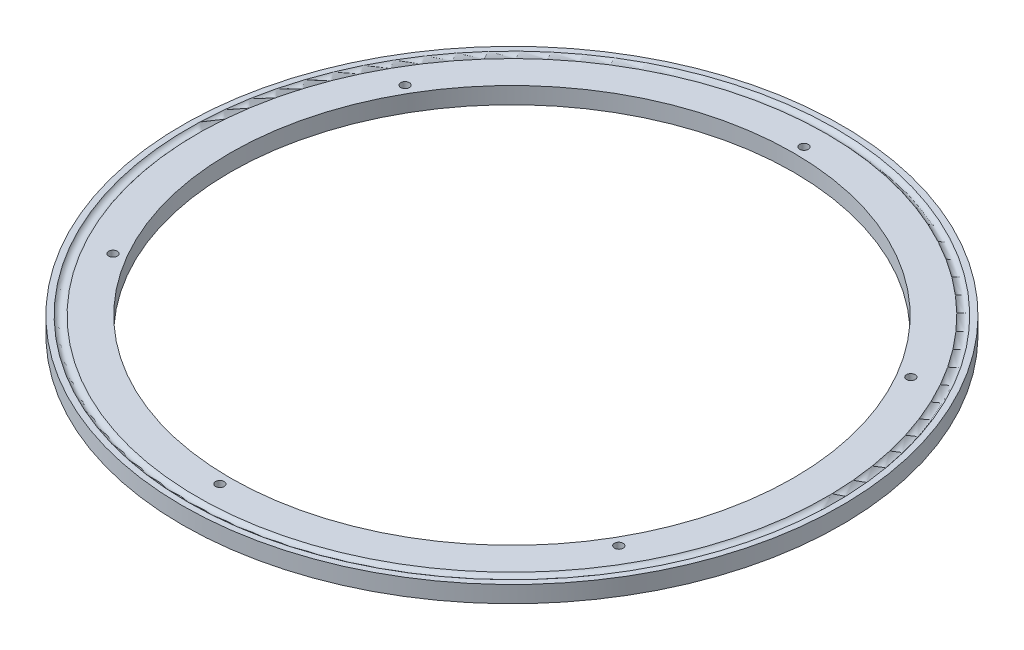
from build123d import *

# Parameters (mm, degrees)
SKETCH1_R           = 100.33
SKETCH1_R_2         = 1.3208
SKETCH1_R_3         = 85.725
BOSS_EXTRUDE1_DEPTH = 5.08


with BuildPart() as part:
    # Sketch1 → Boss-Extrude1 (new body)
    with BuildSketch(Plane(origin=(0, 0, 0), x_dir=(1, 0, 0), z_dir=(0, 1, 0))):
        Circle(SKETCH1_R)
        with Locations((0, 88.9)):
            Circle(SKETCH1_R_2, mode=Mode.SUBTRACT)
        with Locations((-76.989658396, -44.45)):
            Circle(SKETCH1_R_2, mode=Mode.SUBTRACT)
        with Locations((0, -88.9)):
            Circle(SKETCH1_R_2, mode=Mode.SUBTRACT)
        with Locations((76.989658396, -44.45)):
            Circle(SKETCH1_R_2, mode=Mode.SUBTRACT)
        with Locations((-76.989658396, 44.45)):
            Circle(SKETCH1_R_2, mode=Mode.SUBTRACT)
        Circle(SKETCH1_R_3, mode=Mode.SUBTRACT)
        with Locations((76.989658396, 44.45)):
            Circle(SKETCH1_R_2, mode=Mode.SUBTRACT)
    extrude(amount=BOSS_EXTRUDE1_DEPTH)

    # Sketch2 → Cut-Revolve1 (revolve, cut)
    with BuildSketch(Plane(origin=(0, 0, 0), x_dir=(0, 0, -1), z_dir=(1, 0, 0))):
        with BuildLine():
            ThreePointArc((98.546215296, 0), (97.155, 0.762), (95.763784704, 0))
            Line((95.763784704, 0), (98.546215296, 0))
        make_face()
        with BuildLine():
            ThreePointArc((95.763784704, 5.08), (97.155, 4.318), (98.546215296, 5.08))
            Line((98.546215296, 5.08), (95.763784704, 5.08))
        make_face()
    revolve(axis=Axis((0, 0, 0), (0, 1, 0)), mode=Mode.SUBTRACT)


solid = part.part
